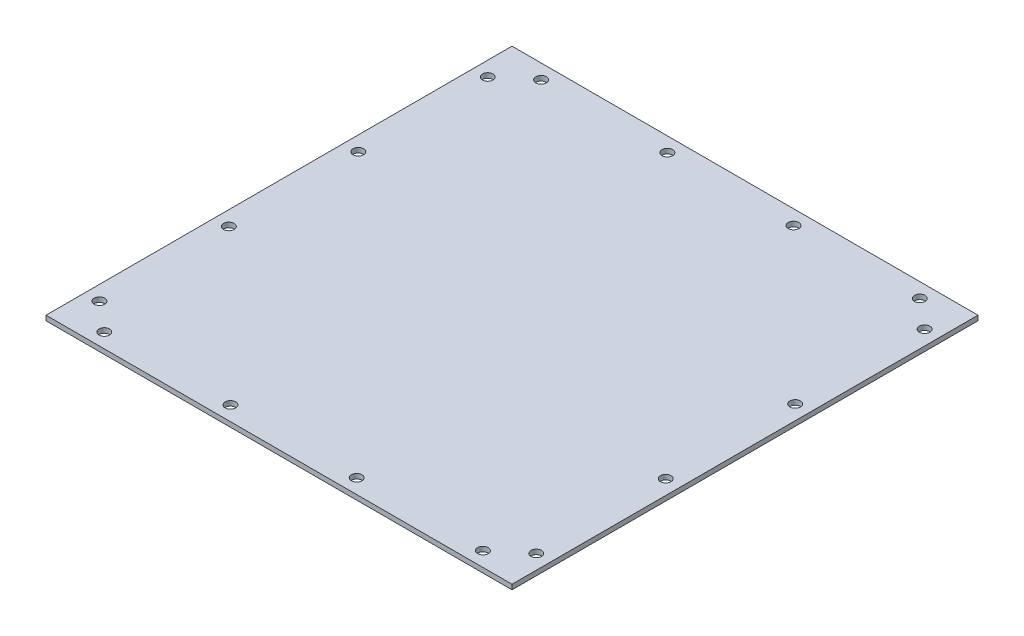
from build123d import *

# Parameters (mm, degrees)
SKETCH2_W             = 152.4
SKETCH2_H             = 152.4
BOSS_EXTRUDE1_DEPTH   = 1.5875
F_5_CLEARANCE_HOLE2_D = 3.4544
F_5_CLEARANCE_HOLE3_D = 3.4544
LPATTERN1_COUNT       = 4
LPATTERN1_PITCH       = 42.333333333
LPATTERN2_COUNT       = 4
LPATTERN2_PITCH       = 41.275


with BuildPart() as part:
    # Sketch2 → Boss-Extrude1 (new body)
    with BuildSketch(Plane(origin=(0, 0, 0), x_dir=(1, 0, 0), z_dir=(0, 1, 0))):
        with Locations((76.2, 76.2)):
            Rectangle(SKETCH2_W, SKETCH2_H)
    extrude(amount=BOSS_EXTRUDE1_DEPTH)

    # #5 Clearance Hole2 (through all)
    with Locations(Plane(origin=(0, 1.5875, 0), x_dir=(1, 0, 0), z_dir=(0, 1, 0))):
        with Locations((14.2875, 147.6375), (14.2875, 4.7625)):
            f_5_clearance_hole2 = Hole(F_5_CLEARANCE_HOLE2_D / 2)

    # #5 Clearance Hole3 (through all)
    with Locations(Plane(origin=(0, 1.5875, 0), x_dir=(1, 0, 0), z_dir=(0, 1, 0))):
        with Locations((4.7625, 139.7), (147.6375, 139.7)):
            f_5_clearance_hole3 = Hole(F_5_CLEARANCE_HOLE3_D / 2)

    # LPattern1: #5 Clearance Hole3 ×4
    with Locations(*[(0, 0, i * LPATTERN1_PITCH) for i in range(1, LPATTERN1_COUNT)]):
        add(f_5_clearance_hole3, mode=Mode.SUBTRACT)

    # LPattern2: #5 Clearance Hole2 ×4
    with Locations(*[(i * LPATTERN2_PITCH, 0, 0) for i in range(1, LPATTERN2_COUNT)]):
        add(f_5_clearance_hole2, mode=Mode.SUBTRACT)


solid = part.part
